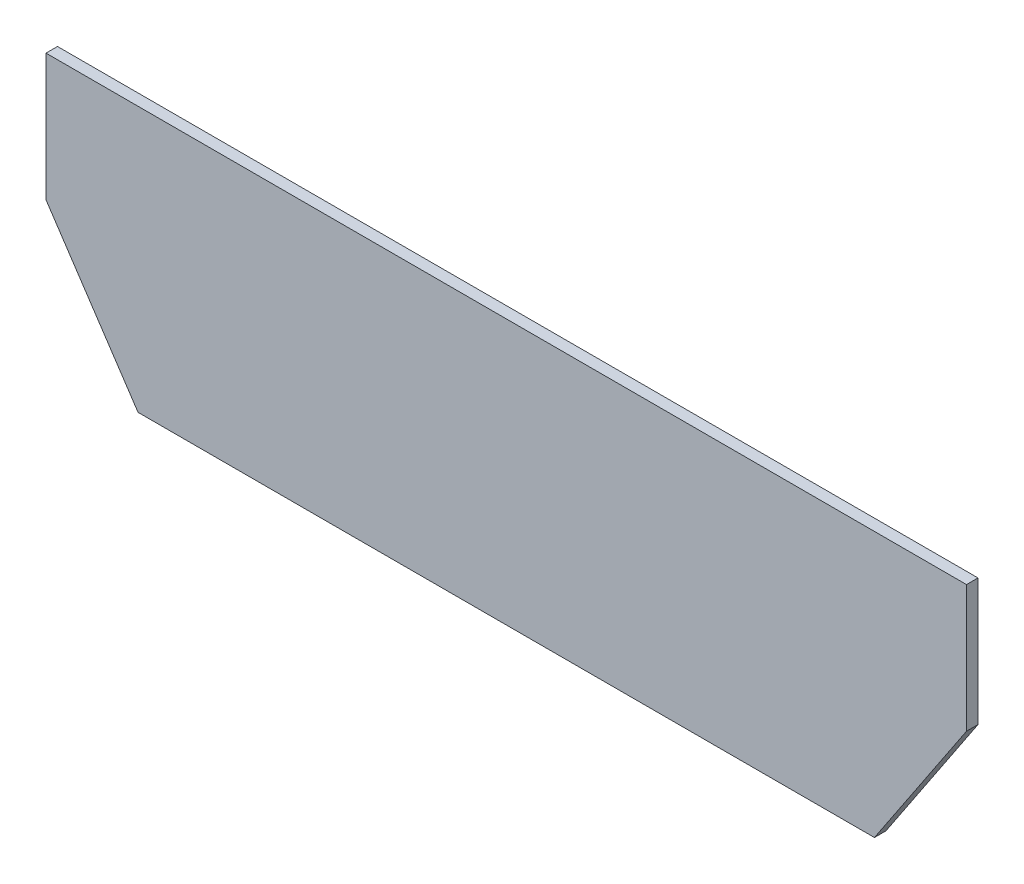
from build123d import *

# Parameters (mm, degrees)
BOSS_EXTRUDE1_DEPTH = 1.5875


with BuildPart() as part:
    # Sketch1 → Boss-Extrude1 (new body)
    with BuildSketch(Plane.XY):
        Polygon((22.225, 2.286), (123.825, 2.286), (136.525, 21.336), (136.525, 38.862), (9.525, 38.862), (9.525, 21.336), align=None)
    extrude(amount=BOSS_EXTRUDE1_DEPTH)


solid = part.part
